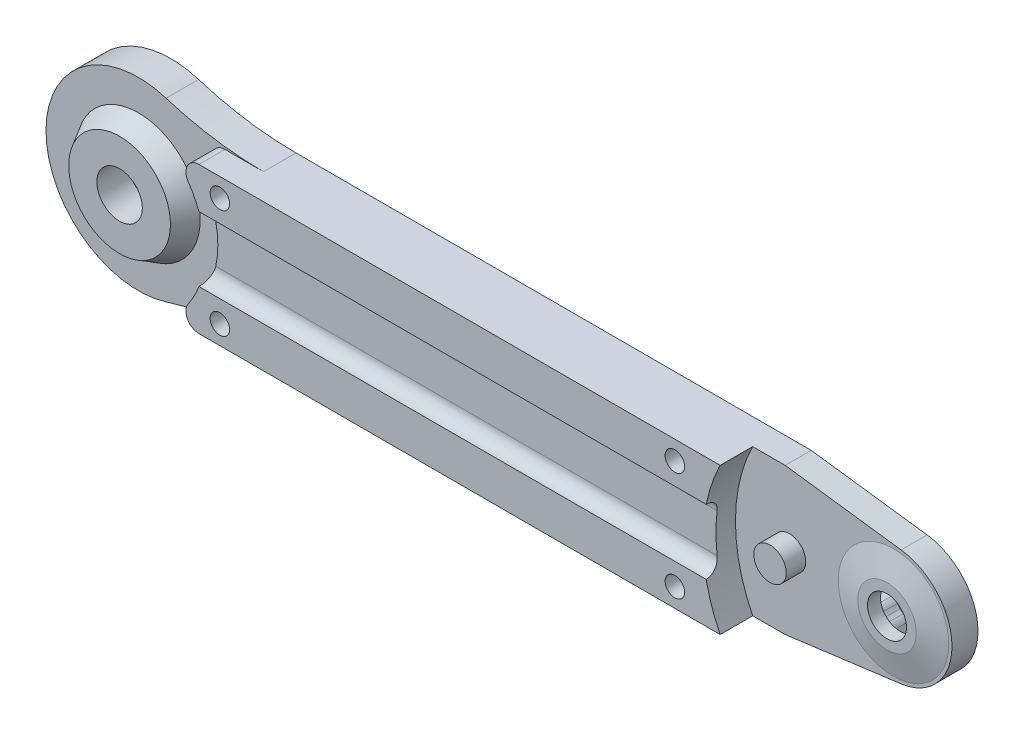
from build123d import *

# Parameters (mm, degrees)
BOSS_EXTRUDE1_DEPTH  = 4
SKETCH2_R            = 2.5
BOSS_EXTRUDE2_DEPTH  = 3
SKETCH5_R            = 4.5
SKETCH3_R            = 8.5
SKETCH6_R            = 3
CUT_EXTRUDE1_DEPTH   = 24.456289064
SKETCH7_W            = 90
SKETCH7_H            = 22.544950424
BOSS_EXTRUDE3_DEPTH  = 4
BOSS_EXTRUDE4_DEPTH  = 5
CUT_EXTRUDE2_DEPTH   = 2
CUT_EXTRUDE3_START   = -2
CUT_EXTRUDE3_DEPTH   = 2
FILLET1_R            = 2
SKETCH12_W           = 13
SKETCH12_H           = 12
CUT_EXTRUDE4_DEPTH   = 2
BOSS_EXTRUDE9_REACH  = 109.642
SKETCH13_R           = 14.22
CUT_EXTRUDE5_START   = -4
SKETCH14_R           = 14.22
CUT_EXTRUDE5_DEPTH   = 4
FILLET2_R            = 50
FILLET3_R            = 50
FILLET4_R            = 2
SKETCH15_R           = 9.5
BOSS_EXTRUDE10_DEPTH = 2.9
BOSS_EXTRUDE10_TAPER = 30
SKETCH16_R           = 3.5
CUT_EXTRUDE6_DEPTH   = 131.409814092
SKETCH17_R           = 1.5
CUT_EXTRUDE7_DEPTH   = 131.481069935
CUT_EXTRUDE8_DEPTH   = 3
CUT_EXTRUDE9_DEPTH   = 3


with BuildPart() as part:
    # Sketch1 → Boss-Extrude1 (new body)
    with BuildSketch(Plane.XY):
        with BuildLine():
            Line((1.17473573, 8.923003752), (-16.671271775, 11.272475212))
            ThreePointArc((-16.671271775, 11.272475212), (-19.953165144, 0), (-16.671271775, -11.272475212))
            Line((-16.671271775, -11.272475212), (1.17473573, -8.923003752))
            ThreePointArc((1.17473573, -8.923003752), (9, 0), (1.17473573, 8.923003752))
        make_face()
    extrude(amount=BOSS_EXTRUDE1_DEPTH)

    # Sketch2 → Boss-Extrude2 (add)
    with BuildSketch(Plane.XY.offset(4)):
        with Locations((-16, 0)):
            Circle(SKETCH2_R)
    extrude(amount=BOSS_EXTRUDE2_DEPTH)

    # Sketch5 → Loft1 section 0
    with BuildSketch(Plane.XY.offset(5)):
        Circle(SKETCH5_R)
    # Sketch3 → Loft1 section 1
    with BuildSketch(Plane.XY.offset(4)):
        Circle(SKETCH3_R)
    loft()

    # Sketch6 → Cut-Extrude1 (cut, through all)
    with BuildSketch(Plane.XY.offset(5)):
        Circle(SKETCH6_R)
    extrude(amount=-CUT_EXTRUDE1_DEPTH, mode=Mode.SUBTRACT)

    # Sketch7 → Boss-Extrude3 (add)
    with BuildSketch(Plane.XY.offset(4)):
        with Locations((-61.671271775, 0)):
            Rectangle(SKETCH7_W, SKETCH7_H)
    extrude(amount=-BOSS_EXTRUDE3_DEPTH)

    # Sketch8 → Boss-Extrude4 (add)
    with BuildSketch(Plane.XY.offset(4)):
        with BuildLine():
            Line((-106.671271775, 11.272475212), (-21.671271775, 11.272475212))
            ThreePointArc((-21.671271775, 11.272475212), (-24.316626975, 0), (-21.671271775, -11.272475212))
            Line((-21.671271775, -11.272475212), (-106.671271775, -11.272475212))
            Line((-106.671271775, -11.272475212), (-106.671271775, 11.272475212))
        make_face()
    extrude(amount=BOSS_EXTRUDE4_DEPTH)

    # Sketch9 → Cut-Extrude2 (cut)
    with BuildSketch(Plane(origin=(0, 0, 0), x_dir=(-1, 0, 0), z_dir=(0, 0, -1))):
        with BuildLine():
            Line((23.091271775, 5), (8.091271775, 3.025212536))
            ThreePointArc((8.091271775, 3.025212536), (8.583093751, 0), (8.091271775, -3.025212536))
            Line((8.091271775, -3.025212536), (23.091271775, -5))
            Line((23.091271775, -5), (106.671271775, -5))
            Line((106.671271775, -5), (106.671271775, 5))
            Line((106.671271775, 5), (23.091271775, 5))
        make_face()
    extrude(amount=-CUT_EXTRUDE2_DEPTH, mode=Mode.SUBTRACT)

    # Sketch11 → Cut-Extrude3 (cut)
    with BuildSketch(Plane.XY.offset(9).offset(CUT_EXTRUDE3_START)):
        with BuildLine():
            Line((-106.671271775, 5), (-23.818438503, 5))
            ThreePointArc((-23.818438503, 5), (-24.316626975, 0), (-23.818438503, -5))
            Line((-23.818438503, -5), (-106.671271775, -5))
            Line((-106.671271775, -5), (-106.671271775, 5))
        make_face()
    extrude(amount=CUT_EXTRUDE3_DEPTH, mode=Mode.SUBTRACT)

    # Fillet1
    fillet1_edges = [part.edges().sort_by_distance(p)[0] for p in [
        (-65.244855139, -5, 7),
        (-65.244855139, 5, 7),
    ]]
    fillet(fillet1_edges, radius=FILLET1_R - 0.0001)  # a hair under: the kernel refuses the full size

    # Sketch12 → Cut-Extrude4 (cut)
    with BuildSketch(Plane(origin=(0, 0, 0), x_dir=(-1, 0, 0), z_dir=(0, 0, -1))):
        with Locations((100.171271775, 0)):
            Rectangle(SKETCH12_W, SKETCH12_H)
    extrude(amount=-CUT_EXTRUDE4_DEPTH, mode=Mode.SUBTRACT)

    # Boss-Extrude9: up to this face of the body (flat: up to its plane)
    boss_extrude9_end = Plane(part.part.faces().sort_by_distance((-64.78254731, 8.149583263, 9))[0])
    # Sketch13 → Boss-Extrude9 (add, up to the picked face)
    with BuildSketch(Plane(origin=(0, 0, 0), x_dir=(-1, 0, 0), z_dir=(0, 0, -1)), mode=Mode.PRIVATE) as boss_extrude9_sk1:
        with Locations((115.171271775, 0)):
            Circle(SKETCH13_R)
    boss_extrude9_tool1 = split(extrude(boss_extrude9_sk1.sketch, amount=-BOSS_EXTRUDE9_REACH, mode=Mode.PRIVATE), bisect_by=boss_extrude9_end, keep=Keep.BOTH, mode=Mode.PRIVATE)
    add(boss_extrude9_tool1.solids().sort_by(Axis((-115.171272, 0, 0), (0, 0, 1)))[0])

    # Sketch14 → Cut-Extrude5 (cut)
    with BuildSketch(Plane.XY.offset(9).offset(CUT_EXTRUDE5_START)):
        with Locations((-115.171271775, 0)):
            Circle(SKETCH14_R)
    extrude(amount=CUT_EXTRUDE5_DEPTH, mode=Mode.SUBTRACT)

    # Fillet2
    fillet2_edges = [part.edges().sort_by_distance(p)[0] for p in [
        (-106.502955757, -11.272475212, 2.5),
    ]]
    fillet(fillet2_edges, radius=FILLET2_R)

    # Fillet3
    fillet3_edges = [part.edges().sort_by_distance(p)[0] for p in [
        (-106.502955757, 11.272475212, 2.5),
    ]]
    fillet(fillet3_edges, radius=FILLET3_R)

    # Fillet4
    fillet4_edges = [part.edges().sort_by_distance(p)[0] for p in [
        (-106.502955757, 11.272475212, 7),
        (-106.502955757, -11.272475212, 7),
    ]]
    fillet(fillet4_edges, radius=FILLET4_R)

    # Sketch15 → Boss-Extrude10 (add)
    with BuildSketch(Plane.XY.offset(5)):
        with Locations((-115.171271775, 0)):
            Circle(SKETCH15_R)
    extrude(amount=BOSS_EXTRUDE10_DEPTH, taper=BOSS_EXTRUDE10_TAPER)

    # Sketch16 → Cut-Extrude6 (cut, through all)
    with BuildSketch(Plane.XY.offset(7.9)):
        with Locations((-115.171271775, 0)):
            Circle(SKETCH16_R)
    extrude(amount=-CUT_EXTRUDE6_DEPTH, mode=Mode.SUBTRACT)

    # Sketch17 → Cut-Extrude7 (cut, through all)
    with BuildSketch(Plane.XY.offset(9)):
        with Locations((-98.64, 8.37)):
            Circle(SKETCH17_R)
        with Locations((-98.64, -8.37)):
            Circle(SKETCH17_R)
        with Locations((-28.64, -8.37)):
            Circle(SKETCH17_R)
        with Locations((-28.64, 8.37)):
            Circle(SKETCH17_R)
    extrude(amount=-CUT_EXTRUDE7_DEPTH, mode=Mode.SUBTRACT)

    # Sketch18 → Cut-Extrude8 (cut)
    with BuildSketch(Plane(origin=(0, 0, 0), x_dir=(-1, 0, 0), z_dir=(0, 0, -1))):
        with BuildLine():
            Line((116.629965164, -7.68), (117.419965164, -4.48))
            ThreePointArc((117.419965164, -4.48), (117.675667138, -3.719084235), (118.209965164, -3.12))
            ThreePointArc((118.209965164, -3.12), (118.224204792, -3.109259088), (118.238318816, -3.098353652))
            ThreePointArc((118.238318816, -3.098353652), (118.249224252, -3.084239628), (118.259965164, -3.07))
            ThreePointArc((118.259965164, -3.07), (118.859049399, -2.535701974), (119.619965164, -2.28))
            Line((119.619965164, -2.28), (122.819965164, -1.49))
            ThreePointArc((122.819965164, -1.49), (123.762740802, -0.995512646), (124.139965164, 0))
            ThreePointArc((124.139965164, 0), (123.762740802, 0.995512646), (122.819965164, 1.49))
            Line((122.819965164, 1.49), (119.619965164, 2.28))
            ThreePointArc((119.619965164, 2.28), (118.859049399, 2.535701974), (118.259965164, 3.07))
            ThreePointArc((118.259965164, 3.07), (118.249224252, 3.084239628), (118.238318816, 3.098353652))
            ThreePointArc((118.238318816, 3.098353652), (118.224204792, 3.109259088), (118.209965164, 3.12))
            ThreePointArc((118.209965164, 3.12), (117.675667138, 3.719084235), (117.419965164, 4.48))
            Line((117.419965164, 4.48), (116.629965164, 7.68))
            ThreePointArc((116.629965164, 7.68), (116.135477809, 8.622775638), (115.139965164, 9))
            ThreePointArc((115.139965164, 9), (114.144452518, 8.622775638), (113.649965164, 7.68))
            Line((113.649965164, 7.68), (112.859965164, 4.48))
            ThreePointArc((112.859965164, 4.48), (112.60426319, 3.719084235), (112.069965164, 3.12))
            ThreePointArc((112.069965164, 3.12), (112.055725536, 3.109259088), (112.041611512, 3.098353652))
            ThreePointArc((112.041611512, 3.098353652), (112.030706076, 3.084239628), (112.019965164, 3.07))
            ThreePointArc((112.019965164, 3.07), (111.420880929, 2.535701974), (110.659965164, 2.28))
            Line((110.659965164, 2.28), (107.459965164, 1.49))
            ThreePointArc((107.459965164, 1.49), (106.517189526, 0.995512646), (106.139965164, 0))
            ThreePointArc((106.139965164, 0), (106.517189526, -0.995512646), (107.459965164, -1.49))
            Line((107.459965164, -1.49), (110.659965164, -2.28))
            ThreePointArc((110.659965164, -2.28), (111.420880929, -2.535701974), (112.019965164, -3.07))
            ThreePointArc((112.019965164, -3.07), (112.030706076, -3.084239628), (112.041611512, -3.098353652))
            ThreePointArc((112.041611512, -3.098353652), (112.055725536, -3.109259088), (112.069965164, -3.12))
            ThreePointArc((112.069965164, -3.12), (112.60426319, -3.719084235), (112.859965164, -4.48))
            Line((112.859965164, -4.48), (113.649965164, -7.68))
            ThreePointArc((113.649965164, -7.68), (114.144452518, -8.622775638), (115.139965164, -9))
            ThreePointArc((115.139965164, -9), (116.135477809, -8.622775638), (116.629965164, -7.68))
        make_face()
    extrude(amount=-CUT_EXTRUDE8_DEPTH, mode=Mode.SUBTRACT)

    # Sketch19 → Cut-Extrude9 (cut)
    with BuildSketch(Plane(origin=(0, 0, 0), x_dir=(-1, 0, 0), z_dir=(0, 0, -1))):
        with BuildLine():
            Line((-1.2, 6.33), (-1.8, 4.16))
            ThreePointArc((-1.8, 4.16), (-2.089343599, 3.728660349), (-2.48, 3.386372183))
            ThreePointArc((-2.48, 3.386372183), (-2.740944688, 3.196252087), (-2.985706385, 2.985706385))
            ThreePointArc((-2.985706385, 2.985706385), (-3.196252087, 2.740944688), (-3.386372183, 2.48))
            ThreePointArc((-3.386372183, 2.48), (-3.728660349, 2.089343599), (-4.16, 1.8))
            Line((-4.16, 1.8), (-6.33, 1.2))
            ThreePointArc((-6.33, 1.2), (-6.992020752, 0.754882576), (-7.25, 0))
            ThreePointArc((-7.25, 0), (-6.992020752, -0.754882576), (-6.33, -1.2))
            Line((-6.33, -1.2), (-4.16, -1.8))
            ThreePointArc((-4.16, -1.8), (-3.728660349, -2.089343599), (-3.386372183, -2.48))
            ThreePointArc((-3.386372183, -2.48), (-3.196252087, -2.740944688), (-2.985706385, -2.985706385))
            ThreePointArc((-2.985706385, -2.985706385), (-2.740944688, -3.196252087), (-2.48, -3.386372183))
            ThreePointArc((-2.48, -3.386372183), (-2.089343599, -3.728660349), (-1.8, -4.16))
            Line((-1.8, -4.16), (-1.2, -6.33))
            ThreePointArc((-1.2, -6.33), (-0.754882576, -6.992020752), (0, -7.25))
            ThreePointArc((0, -7.25), (0.754882576, -6.992020752), (1.2, -6.33))
            Line((1.2, -6.33), (1.8, -4.16))
            ThreePointArc((1.8, -4.16), (2.089343599, -3.728660349), (2.48, -3.386372183))
            ThreePointArc((2.48, -3.386372183), (2.740944688, -3.196252087), (2.985706385, -2.985706385))
            ThreePointArc((2.985706385, -2.985706385), (3.196252087, -2.740944688), (3.386372183, -2.48))
            ThreePointArc((3.386372183, -2.48), (3.728660349, -2.089343599), (4.16, -1.8))
            Line((4.16, -1.8), (6.33, -1.2))
            ThreePointArc((6.33, -1.2), (6.992020752, -0.754882576), (7.25, 0))
            ThreePointArc((7.25, 0), (6.992020752, 0.754882576), (6.33, 1.2))
            Line((6.33, 1.2), (4.16, 1.8))
            ThreePointArc((4.16, 1.8), (3.728660349, 2.089343599), (3.386372183, 2.48))
            ThreePointArc((3.386372183, 2.48), (3.196252087, 2.740944688), (2.985706385, 2.985706385))
            ThreePointArc((2.985706385, 2.985706385), (2.740944688, 3.196252087), (2.48, 3.386372183))
            ThreePointArc((2.48, 3.386372183), (2.089343599, 3.728660349), (1.8, 4.16))
            Line((1.8, 4.16), (1.2, 6.33))
            ThreePointArc((1.2, 6.33), (0.754882576, 6.992020752), (0, 7.25))
            ThreePointArc((0, 7.25), (-0.754882576, 6.992020752), (-1.2, 6.33))
        make_face()
    extrude(amount=-CUT_EXTRUDE9_DEPTH, mode=Mode.SUBTRACT)


solid = part.part
